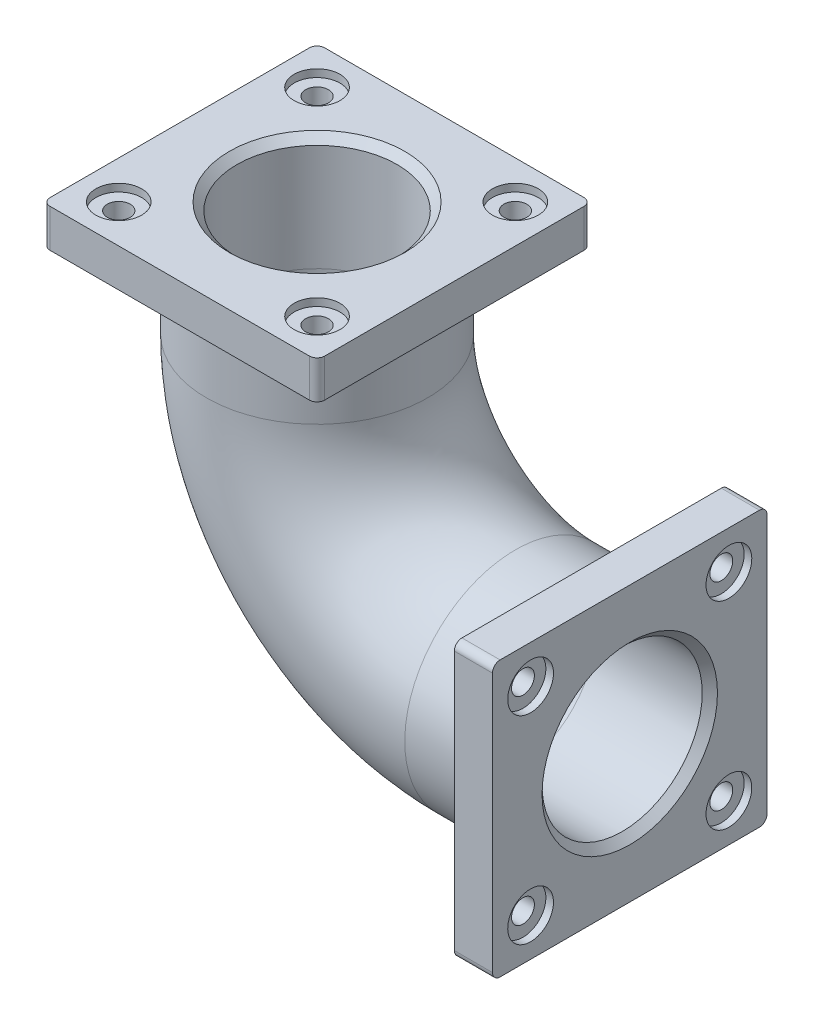
from build123d import *

# Parameters (mm, degrees)
SKETCH2_R                 = 145
SKETCH2_R_2               = 105
BOSS_EXTRUDE1_START       = -50
SKETCH3_W                 = 360
SKETCH3_H                 = 360
SKETCH3_R                 = 145
BOSS_EXTRUDE1_DEPTH       = 50
FILLET1_R                 = 10
SKETCH4_W                 = 360
SKETCH4_H                 = 360
SKETCH4_R                 = 145
BOSS_EXTRUDE2_DEPTH       = 50
FILLET2_R                 = 10
SKETCH5_R                 = 30
CUT_EXTRUDE1_DEPTH        = 10
CUT_EXTRUDE2_REACH        = 734.735
SKETCH7_R                 = 15
CIRPATTERN1_COUNT         = 4
SKETCH8_R                 = 30
CUT_EXTRUDE3_DEPTH        = 10
SKETCH9_R                 = 15
CUT_EXTRUDE4_DEPTH        = 847.69947443
CIRPATTERN4_START         = 360
CIRPATTERN4_OUTLINE_R     = 15
CIRPATTERN4_DEPTH         = 50
CIRPATTERN4_START_2       = 400
CIRPATTERN4_2_OUTLINE_R   = 30
CIRPATTERN4_2_OUTLINE_R_2 = 15
CIRPATTERN4_2_DEPTH       = 10
CHAMFER1_SIZE             = 10
CHAMFER2_SIZE             = 10


# Read off the part's stored shape, not the designer's step: CirPattern4
with BuildPart() as part:
    # Sweep-Thin1: sweep along a path in Sketch1
    with BuildLine(Plane.XY) as sweep_thin1_path:
        Line((0, 0), (-150, 0))
        ThreePointArc((-150, 0), (-333.847763109, 76.152236891), (-410, 260))
        Line((-410, 260), (-410, 410))
    # Sketch2 → Sweep-Thin1 (sweep)
    with BuildSketch(Plane(origin=(0, 0, 0), x_dir=(0, 0, -1), z_dir=(1, 0, 0))):
        Circle(SKETCH2_R)
        Circle(SKETCH2_R_2, mode=Mode.SUBTRACT)
    sweep(path=sweep_thin1_path.line)

    # Sketch3 → Boss-Extrude1 (add)
    with BuildSketch(Plane(origin=(0, 0, 0), x_dir=(0, 0, -1), z_dir=(1, 0, 0)).offset(BOSS_EXTRUDE1_START)):
        Rectangle(SKETCH3_W, SKETCH3_H)
        with Locations(Location((0, 0, 0), (0, 0, 270))):
            Circle(SKETCH3_R, mode=Mode.SUBTRACT)
    extrude(amount=BOSS_EXTRUDE1_DEPTH)

    # Fillet1
    fillet1_edges = [part.edges().sort_by_distance(p)[0] for p in [
        (-25, 180, -180),
        (-25, -180, -180),
        (-25, -180, 180),
        (-25, 180, 180),
    ]]
    fillet(fillet1_edges, radius=FILLET1_R)

    # Sketch4 → Boss-Extrude2 (add)
    with BuildSketch(Plane(origin=(0, 410, 0), x_dir=(1, 0, 0), z_dir=(0, 1, 0))):
        with Locations((-410, 0)):
            Rectangle(SKETCH4_W, SKETCH4_H)
        with Locations(Location((-410, 0, 0), (0, 0, 180))):
            Circle(SKETCH4_R, mode=Mode.SUBTRACT)
    extrude(amount=-BOSS_EXTRUDE2_DEPTH)

    # Fillet2
    fillet2_edges = [part.edges().sort_by_distance(p)[0] for p in [
        (-230, 385, -180),
        (-230, 385, 180),
        (-590, 385, 180),
        (-590, 385, -180),
    ]]
    fillet(fillet2_edges, radius=FILLET2_R)

    # Sketch5 → Cut-Extrude1 (cut)
    with BuildSketch(Plane(origin=(0, 0, 0), x_dir=(0, 0, -1), z_dir=(1, 0, 0))):
        with Locations((-130, 130)):
            Circle(SKETCH5_R)
    cut_extrude1 = extrude(amount=-CUT_EXTRUDE1_DEPTH, mode=Mode.SUBTRACT)

    # Sketch7 → Cut-Extrude2 (cut, up to next)
    with BuildSketch(Plane(origin=(-10, 0, 0), x_dir=(0, 0, -1), z_dir=(1, 0, 0)), mode=Mode.PRIVATE) as cut_extrude2_sk1:
        with Locations((-130, 130)):
            Circle(SKETCH7_R)
    cut_extrude2_tool1 = extrude(cut_extrude2_sk1.sketch, amount=-CUT_EXTRUDE2_REACH, mode=Mode.PRIVATE) & part.part
    cut_extrude2 = cut_extrude2_tool1.solids().sort_by_distance((-10, 130, 130))[0]
    add(cut_extrude2, mode=Mode.SUBTRACT)

    # CirPattern1: Cut-Extrude1, Cut-Extrude2 ×4 about axis
    cirpattern1_axis = Axis((0, 0, 0), (1, 0, 0))
    add([cut_extrude1.rotate(cirpattern1_axis, i * 360 / CIRPATTERN1_COUNT) for i in range(1, CIRPATTERN1_COUNT)], mode=Mode.SUBTRACT)
    add([cut_extrude2.rotate(cirpattern1_axis, i * 360 / CIRPATTERN1_COUNT) for i in range(1, CIRPATTERN1_COUNT)], mode=Mode.SUBTRACT)

    # Sketch8 → Cut-Extrude3 (cut)
    with BuildSketch(Plane(origin=(0, 410, 0), x_dir=(1, 0, 0), z_dir=(0, 1, 0))):
        with Locations(Location((-540, 130, 0), (0, 0, 180))):
            Circle(SKETCH8_R)
    extrude(amount=-CUT_EXTRUDE3_DEPTH, mode=Mode.SUBTRACT)

    # Sketch9 → Cut-Extrude4 (cut, through all)
    with BuildSketch(Plane(origin=(0, 400, 0), x_dir=(1, 0, 0), z_dir=(0, 1, 0))):
        with Locations(Location((-540, 130, 0), (0, 0, 180))):
            Circle(SKETCH9_R)
    extrude(amount=-CUT_EXTRUDE4_DEPTH, mode=Mode.SUBTRACT)

    # CirPattern4 outline → CirPattern4 (cut)
    with BuildSketch(Plane(origin=(0, 0, 0), x_dir=(1, 0, 0), z_dir=(0, 1, 0)).offset(CIRPATTERN4_START)):
        with Locations((-280, 130)):
            Circle(CIRPATTERN4_OUTLINE_R)
        with Locations((-280, -130)):
            Circle(CIRPATTERN4_OUTLINE_R)
        with Locations((-540, -130)):
            Circle(CIRPATTERN4_OUTLINE_R)
    extrude(amount=CIRPATTERN4_DEPTH, mode=Mode.SUBTRACT)

    # CirPattern4 2 outline → CirPattern4 2 (cut)
    # profile 1 of 3: a face of its own
    with BuildSketch(Plane(origin=(0, 0, 0), x_dir=(1, 0, 0), z_dir=(0, 1, 0)).offset(CIRPATTERN4_START_2)):
        with Locations((-280, 130)):
            Circle(CIRPATTERN4_2_OUTLINE_R)
        with Locations((-280, 130)):
            Circle(CIRPATTERN4_2_OUTLINE_R_2, mode=Mode.SUBTRACT)
    # profile 2 of 3: a face of its own
    with BuildSketch(Plane(origin=(0, 0, 0), x_dir=(1, 0, 0), z_dir=(0, 1, 0)).offset(CIRPATTERN4_START_2)):
        with Locations((-280, -130)):
            Circle(CIRPATTERN4_2_OUTLINE_R)
        with Locations((-280, -130)):
            Circle(CIRPATTERN4_2_OUTLINE_R_2, mode=Mode.SUBTRACT)
    # profile 3 of 3: a face of its own
    with BuildSketch(Plane(origin=(0, 0, 0), x_dir=(1, 0, 0), z_dir=(0, 1, 0)).offset(CIRPATTERN4_START_2)):
        with Locations((-540, -130)):
            Circle(CIRPATTERN4_2_OUTLINE_R)
        with Locations((-540, -130)):
            Circle(CIRPATTERN4_2_OUTLINE_R_2, mode=Mode.SUBTRACT)
    extrude(amount=CIRPATTERN4_2_DEPTH, mode=Mode.SUBTRACT)

    # Chamfer1
    chamfer1_edges = [part.edges().sort_by_distance(p)[0] for p in [
        (0, 0, 105),
    ]]
    chamfer(chamfer1_edges, length=CHAMFER1_SIZE)

    # Chamfer2
    chamfer2_edges = [part.edges().sort_by_distance(p)[0] for p in [
        (-410, 410, 105),
    ]]
    chamfer(chamfer2_edges, length=CHAMFER2_SIZE)


solid = part.part
